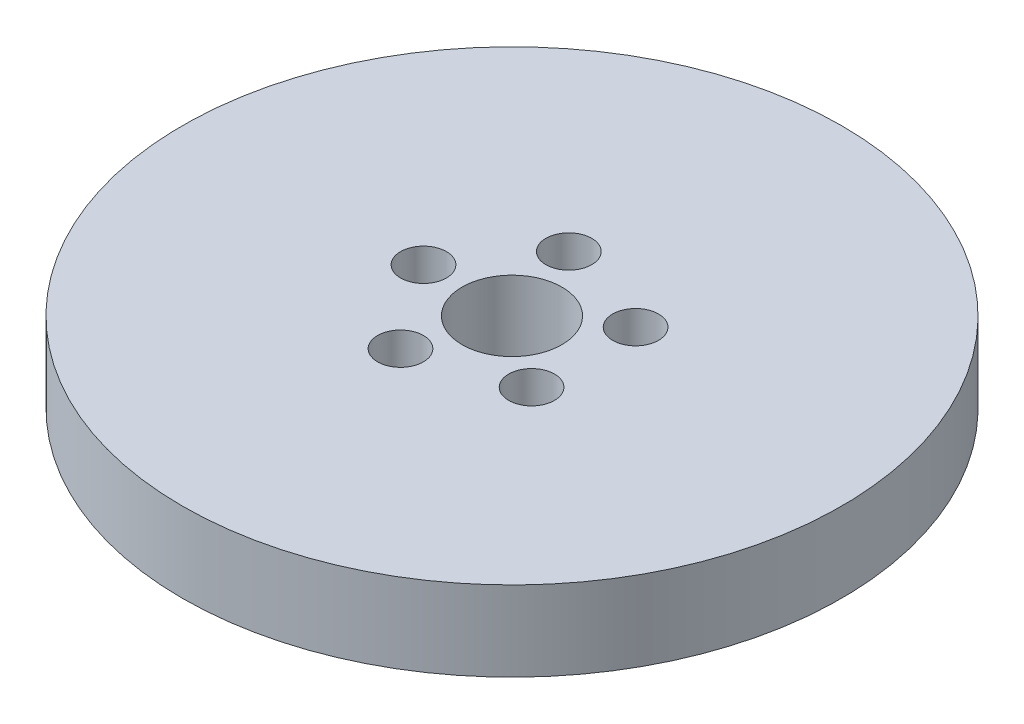
from build123d import *

# Parameters (mm, degrees)
SKETCH1_R           = 82.5
BOSS_EXTRUDE1_DEPTH = 20
SKETCH2_R           = 12.5
CUT_EXTRUDE1_DEPTH  = 119.374406018
SKETCH3_R           = 5.733908255
CUT_EXTRUDE2_DEPTH  = 15.896466126
CIRPATTERN1_COUNT   = 5


with BuildPart() as part:
    # Sketch1 → Boss-Extrude1 (new body)
    with BuildSketch(Plane(origin=(0, 0, 0), x_dir=(1, 0, 0), z_dir=(0, 1, 0))):
        Circle(SKETCH1_R)
    extrude(amount=BOSS_EXTRUDE1_DEPTH)

    # Sketch2 → Cut-Extrude1 (cut, through all)
    with BuildSketch(Plane(origin=(0, 0, 0), x_dir=(1, 0, 0), z_dir=(0, 1, 0))):
        Circle(SKETCH2_R)
    extrude(amount=CUT_EXTRUDE1_DEPTH, mode=Mode.SUBTRACT)

    # Sketch3 → Cut-Extrude2 (cut)
    with BuildSketch(Plane(origin=(0, 20, 0), x_dir=(1, 0, 0), z_dir=(0, 1, 0))):
        with Locations((-22.150756297, 0)):
            Circle(SKETCH3_R)
    cut_extrude2 = extrude(amount=-CUT_EXTRUDE2_DEPTH, mode=Mode.SUBTRACT)

    # CirPattern1: Cut-Extrude2 ×5 about axis
    cirpattern1_axis = Axis((0, 0, 0), (0, 1, 0))
    for i in range(1, CIRPATTERN1_COUNT):
        add(cut_extrude2.rotate(cirpattern1_axis, i * 360 / CIRPATTERN1_COUNT), mode=Mode.SUBTRACT)


solid = part.part
